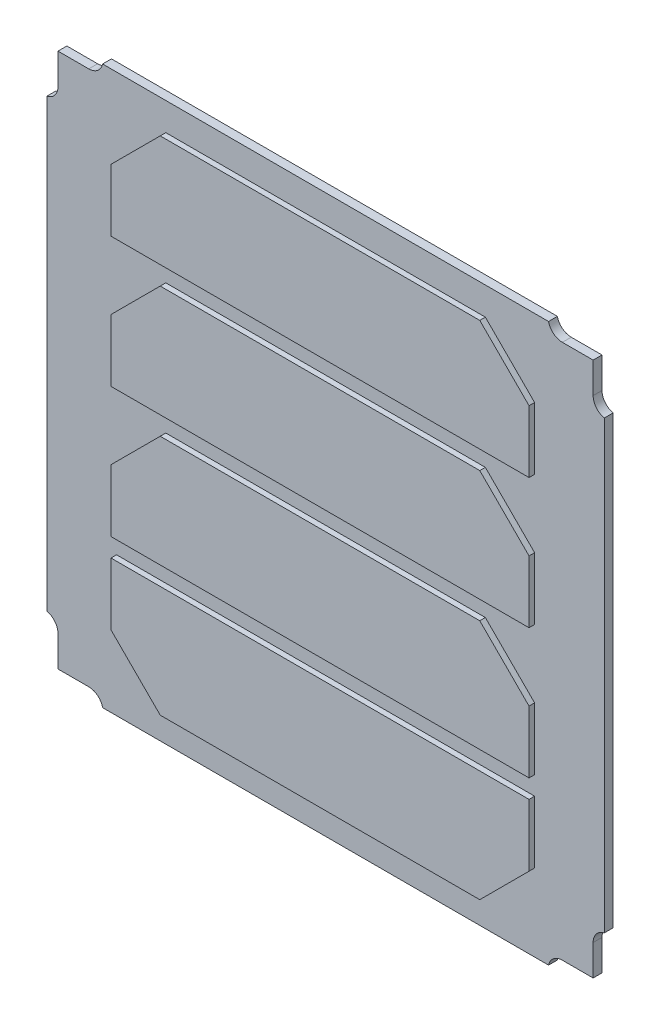
from build123d import *

# Parameters (mm, degrees)
BOSS_EXTRUDE1_DEPTH = 1.5875
BOSS_EXTRUDE2_DEPTH = 1
FILLET1_R           = 2.54


with BuildPart() as part:
    # Sketch1 → Boss-Extrude1 (new body)
    with BuildSketch(Plane.XY):
        Polygon((40, 50), (-40, 50), (-40, 48), (-48, 48), (-48, 40), (-50, 40), (-50, -37.864895224), (-50, -40), (-48, -40), (-48, -48), (-40, -48), (-40, -50), (-37.864895224, -50), (40, -50), (40, -48), (48, -48), (48, -40), (50, -40), (50, 40), (48, 40), (48, 48), (40, 48), align=None)
    extrude(amount=BOSS_EXTRUDE1_DEPTH)

    # Sketch2 → Boss-Extrude2 (add)
    with BuildSketch(Plane.XY.offset(1.5875)):
        Polygon((-28.661165235, 45), (28.661165235, 45), (37.5, 36.161165235), (37.5, 25), (-37.5, 25), (-37.5, 36.161165235), align=None)
        Polygon((-28.661165235, 21.666666667), (28.661165235, 21.666666667), (37.5, 12.827831902), (37.5, 1.666666667), (-37.5, 1.666666667), (-37.5, 12.827831902), align=None)
        Polygon((-28.661165235, -1.666666667), (28.661165235, -1.666666667), (37.5, -10.505501431), (37.5, -21.666666667), (-37.5, -21.666666667), (-37.5, -10.505501431), align=None)
        Polygon((-37.5, -36.161165235), (-28.661165235, -45), (28.661165235, -45), (37.5, -36.161165235), (37.5, -25), (-37.5, -25), align=None)
    extrude(amount=BOSS_EXTRUDE2_DEPTH)

    # Fillet1
    # the kernel refuses this fillet: 2.54 mm, written as the material it adds along each edge
    with BuildSketch(Plane(origin=(-48, -40, 0), x_dir=(-1.0, -3.6735059438767946e-12, 0), z_dir=(0, 0, 1)), Plane(origin=(40, -48, 0), x_dir=(3.808509063671012e-12, -1.0, 0), z_dir=(0, 0, 1)), Plane(origin=(48, 40, 0), x_dir=(1.0, 3.659295089161617e-12, 0), z_dir=(0, 0, 1)), Plane(origin=(-40, 48, 0), x_dir=(-3.7978509226345916e-12, 1.0, 0), z_dir=(0, 0, 1))) as fillet1_piece_1:
        with BuildLine():
            CenterArc((2.54, 2.481934729), FILLET1_R, 180, 77.725329785)
            Line((0, 2.481934729), (-0.0508, 2.481934729))
            Line((-0.0508, 2.481934729), (-0.0508, 0))
            Line((-0.0508, 0), (0, -0.0508))
            ThreePointArc((0, -0.0508), (1, -0.0508), (1.9892, -0.049638695))
            Line((1.9892, -0.049638695), (2, 0))
        make_face()
    extrude(amount=1.5875)
    with BuildSketch(Plane(origin=(-40, -48, 0), x_dir=(-1, 0, 0), z_dir=(0, 0, 1)), Plane(origin=(48, -40, 0), x_dir=(0, -1, 0), z_dir=(0, 0, 1)), Plane(origin=(-48, 40, 0), x_dir=(0, 1, 0), z_dir=(0, 0, 1))) as fillet1_piece_2:
        with BuildLine():
            CenterArc((2.481934729, 2.54), FILLET1_R, 192.274670215, 77.725329785)
            Line((0, 2), (-0.049638695, 1.9892))
            ThreePointArc((-0.049638695, 1.9892), (-0.0508, 1), (-0.0508, 0))
            Line((-0.0508, 0), (0, -0.0508))
            Line((0, -0.0508), (2.481934729, -0.0508))
            Line((2.481934729, -0.0508), (2.481934729, 0))
        make_face()
    extrude(amount=1.5875)
    with BuildSketch(Plane(origin=(40, 48, 0), x_dir=(3.726796649058746e-12, 1.0, 0), z_dir=(0, 0, 1))) as fillet1_piece_3:
        with BuildLine():
            CenterArc((2.54, -2.481934729), FILLET1_R, 102.274670215, 77.725329785)
            Line((0, -2.481934729), (-0.0508, -2.481934729))
            Line((-0.0508, -2.481934729), (-0.0508, 0))
            Line((-0.0508, 0), (0, 0.0508))
            ThreePointArc((0, 0.0508), (1, 0.0508), (1.9892, 0.049638695))
            Line((1.9892, 0.049638695), (2, 0))
        make_face()
    extrude(amount=1.5875)


solid = part.part
